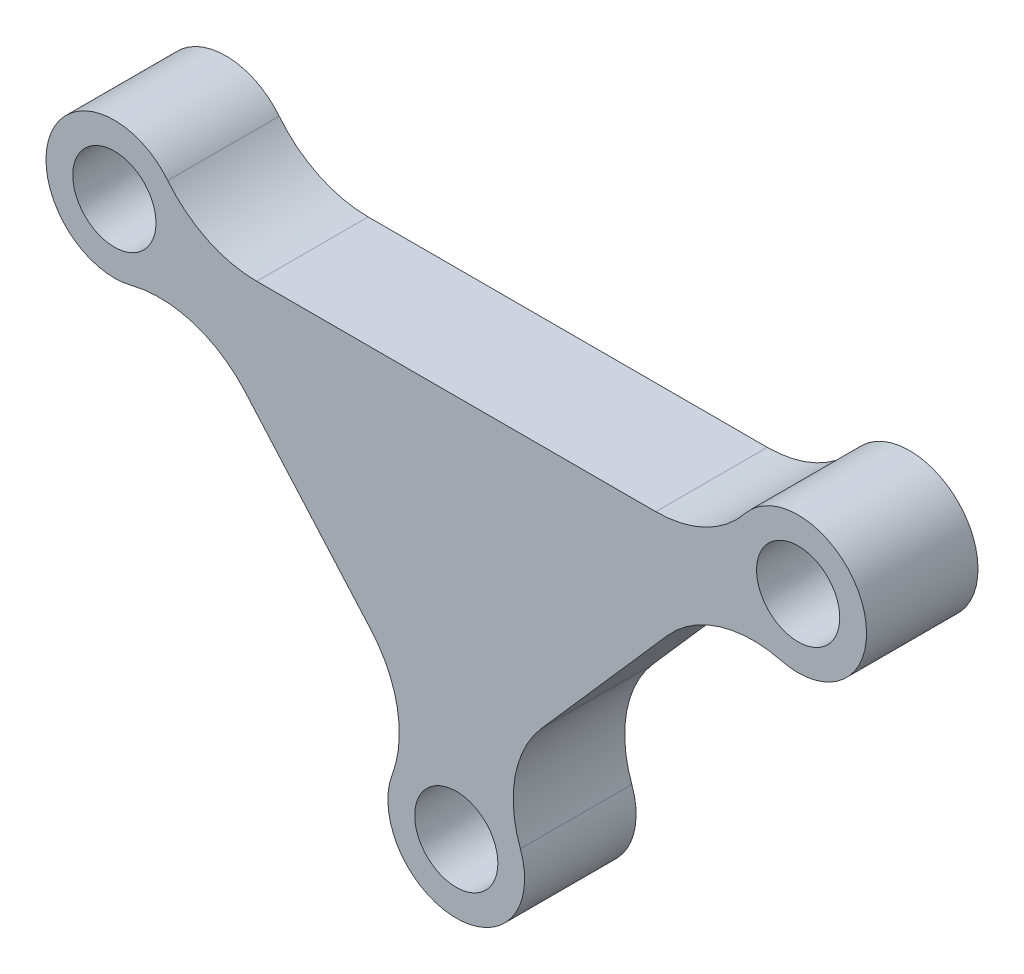
from build123d import *

# Parameters (mm, degrees)
ESQUISSE2_R        = 1.825
BOSS_EXTRU_1_DEPTH = 4.89
CONG_1_R           = 5


with BuildPart() as part:
    # Esquisse2 → Boss.-Extru.1 (new body)
    with BuildSketch(Plane.XY):
        with BuildLine():
            ThreePointArc((-12, 10), (-17.947310062, 10.559788709), (-12.208908932, 8.900086071))
            Line((-12.208908932, 8.900086071), (-0.908352526, -3.965822551))
            ThreePointArc((-0.908352526, -3.965822551), (0, -9.825), (0.908352526, -3.965822551))
            Line((0.908352526, -3.965822551), (12.208908932, 8.900086071))
            ThreePointArc((12.208908932, 8.900086071), (17.947310062, 10.559788709), (12, 10))
            Line((12, 10), (-12, 10))
        make_face()
        with Locations((-15, 10)):
            Circle(ESQUISSE2_R, mode=Mode.SUBTRACT)
        with Locations((15, 10)):
            Circle(ESQUISSE2_R, mode=Mode.SUBTRACT)
        with Locations((0, -6.825)):
            Circle(ESQUISSE2_R, mode=Mode.SUBTRACT)
    extrude(amount=BOSS_EXTRU_1_DEPTH)

    # Congé1
    cong_1_edges = [part.edges().sort_by_distance(p)[0] for p in [
        (-12, 10, 2.445),
        (-12.208908932, 8.900086071, 2.445),
        (-0.908352526, -3.965822551, 2.445),
        (12.208908932, 8.900086071, 2.445),
        (12, 10, 2.445),
        (0.908352526, -3.965822551, 2.445),
    ]]
    fillet(cong_1_edges, radius=CONG_1_R)


solid = part.part
